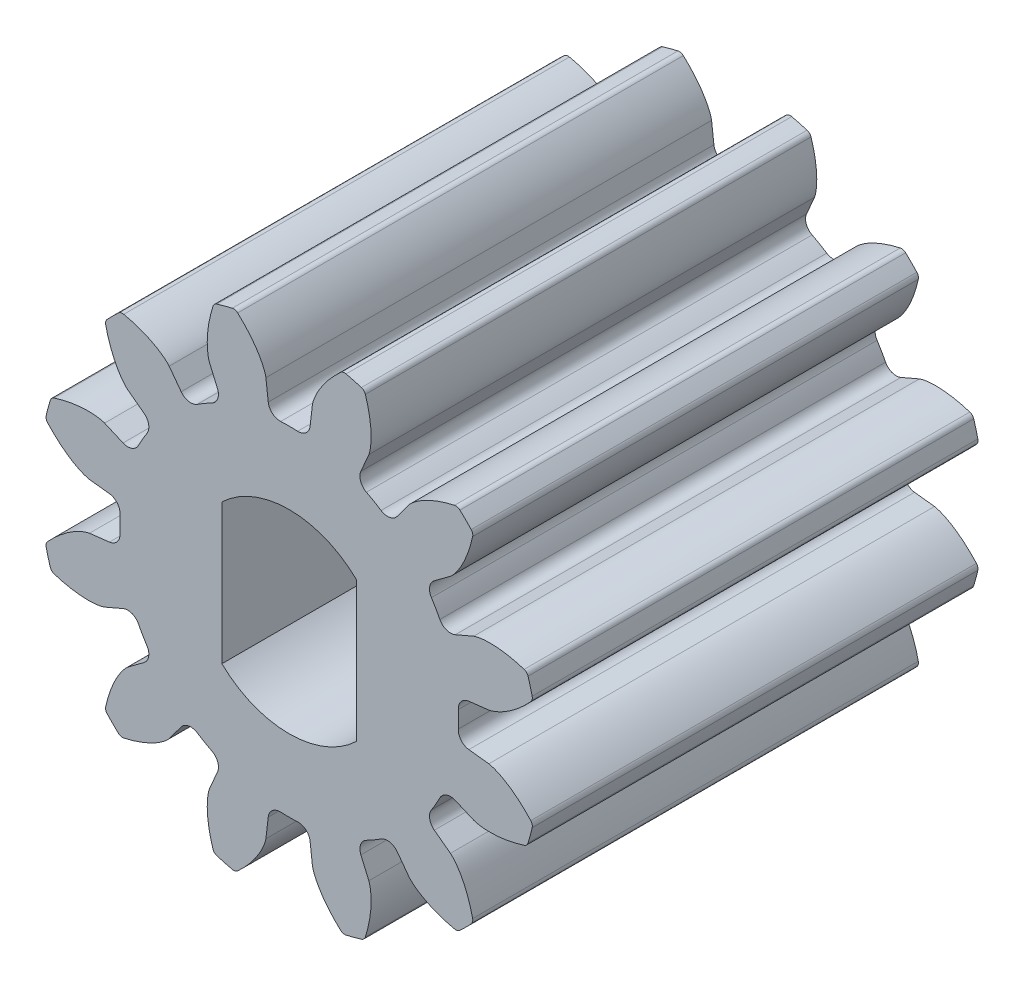
from build123d import *

# Parameters (mm, degrees)
SKETCH1_R                                 = 7.112
BOSS_EXTRUDE1_DEPTH                       = 12.7
CUT_EXTRUDE_DCLTBC_DEPTH                  = 17.200342219
FILLET_TIP_DCLTBC_R                       = 0.170436558
FILLET_ROOT_DCLTBC_R                      = 0.340873116
CIRPATTERN_DCLTBC_COUNT                   = 12
FILLET_TIP_DCLTBC_OF_CIRPATTERN_DCLTBC_R  = 0.170436558
FILLET_ROOT_DCLTBC_OF_CIRPATTERN_DCLTBC_R = 0.340873116
CUT_EXTRUDE1_DEPTH                        = 17.041149826


with BuildPart() as part:
    # Sketch1 → Boss-Extrude1 (new body)
    with BuildSketch(Plane.XY):
        Circle(SKETCH1_R)
    extrude(amount=BOSS_EXTRUDE1_DEPTH)

    # DCLTBC → Cut-Extrude-DCLTBC (cut, through all)
    with BuildSketch(Plane.XY):
        with BuildLine():
            Line((-0.662974567, 5.689872075), (-0.558538882, 4.793569684))
            ThreePointArc((-0.558538882, 4.793569684), (0, 4.826), (0.558538882, 4.793569684))
            Line((0.558538882, 4.793569684), (0.662974567, 5.689872075))
            add(Edge.make_bspline(
                [(0.662974567, 5.689872075), (0.663275397, 5.692145464), (0.664228697, 5.698506862), (0.666463146, 5.710471636), (0.670720167, 5.729889389), (0.677039415, 5.754461613), (0.686229455, 5.786001566), (0.698363916, 5.822849076), (0.713061744, 5.862991037), (0.730512439, 5.906252019), (0.749205224, 5.949022812), (0.769037864, 5.991304795), (0.789858477, 6.033063367), (0.81632592, 6.083195998), (0.849790681, 6.142668259), (0.891392381, 6.211185136), (0.941487387, 6.287669165), (0.995607559, 6.364224937), (1.051365877, 6.438382008), (1.110528205, 6.511878211), (1.169770874, 6.581970613), (1.234132655, 6.653215412), (1.294986248, 6.718191166), (1.366224175, 6.789174393), (1.424614, 6.845936255), (1.48743381, 6.90300279), (1.518375469, 6.930543324), (1.534342146, 6.944518571)],
                knots=[0, 0, 0, 0, 0, 0.005376749, 0.015083688, 0.02853182, 0.046610139, 0.064854849, 0.092110525, 0.119476176, 0.146842496, 0.174208854, 0.201574956, 0.228941013, 0.256307345, 0.307035032, 0.361767352, 0.416499661, 0.471231937, 0.525964282, 0.580696615, 0.635428982, 0.690161387, 0.744893688, 0.799626082, 0.854358408, 0.909090915, 0.909090915, 0.909090915, 0.909090915, 0.909090915], degree=4))
            ThreePointArc((1.534342146, 6.944518571), (0, 7.112), (-1.534342146, 6.944518571))
            add(Edge.make_bspline(
                [(-0.662974567, 5.689872075), (-0.663275397, 5.692145464), (-0.664228697, 5.698506862), (-0.666463146, 5.710471636), (-0.670720167, 5.729889389), (-0.677039415, 5.754461613), (-0.686229455, 5.786001566), (-0.698363916, 5.822849076), (-0.713061744, 5.862991037), (-0.730512439, 5.906252019), (-0.749205224, 5.949022812), (-0.769037864, 5.991304795), (-0.789858477, 6.033063367), (-0.81632592, 6.083195998), (-0.849790681, 6.142668259), (-0.891392381, 6.211185136), (-0.941487387, 6.287669165), (-0.995607559, 6.364224937), (-1.051365877, 6.438382008), (-1.110528205, 6.511878211), (-1.169770874, 6.581970613), (-1.234132655, 6.653215412), (-1.294986248, 6.718191166), (-1.366224175, 6.789174393), (-1.424614, 6.845936255), (-1.48743381, 6.90300279), (-1.518375469, 6.930543324), (-1.534342146, 6.944518571)],
                knots=[0, 0, 0, 0, 0, 0.005376749, 0.015083688, 0.02853182, 0.046610139, 0.064854849, 0.092110525, 0.119476176, 0.146842496, 0.174208854, 0.201574956, 0.228941013, 0.256307345, 0.307035032, 0.361767352, 0.416499661, 0.471231937, 0.525964282, 0.580696615, 0.635428982, 0.690161387, 0.744893688, 0.799626082, 0.854358408, 0.909090915, 0.909090915, 0.909090915, 0.909090915, 0.909090915], degree=4))
        make_face()
    cut_extrude_dcltbc = extrude(amount=CUT_EXTRUDE_DCLTBC_DEPTH, mode=Mode.SUBTRACT)

    # Fillet-Tip-DCLTBC
    fillet_tip_dcltbc_edges = [part.edges().sort_by_distance(p)[0] for p in [
        (1.534342146, 6.944518571, 6.35),
        (-1.534342146, 6.944518571, 6.35),
    ]]
    fillet(fillet_tip_dcltbc_edges, radius=FILLET_TIP_DCLTBC_R)

    # Fillet-Root-DCLTBC
    fillet_root_dcltbc_edges = [part.edges().sort_by_distance(p)[0] for p in [
        (-0.558538882, 4.793569684, 6.35),
        (0.558538882, 4.793569684, 6.35),
    ]]
    fillet(fillet_root_dcltbc_edges, radius=FILLET_ROOT_DCLTBC_R)

    # CirPattern-DCLTBC: Cut-Extrude-DCLTBC ×12 about axis
    cirpattern_dcltbc_axis = Axis((0, 0, 12.7), (0, 0, 1))
    for i in range(1, CIRPATTERN_DCLTBC_COUNT):
        add(cut_extrude_dcltbc.rotate(cirpattern_dcltbc_axis, i * 360 / CIRPATTERN_DCLTBC_COUNT), mode=Mode.SUBTRACT)

    # Fillet-Tip-DCLTBC of CirPattern-DCLTBC
    fillet_tip_dcltbc_of_cirpattern_dcltbc_edges = [part.edges().sort_by_distance(p)[0] for p in [
        (-2.143480009, 6.781300572, 6.35),
        (-4.801038562, 5.246958426, 6.35),
        (-5.246958426, 4.801038562, 6.35),
        (-6.781300572, 2.143480009, 6.35),
        (-6.944518571, 1.534342146, 6.35),
        (-6.944518571, -1.534342146, 6.35),
        (-6.781300572, -2.143480009, 6.35),
        (-5.246958426, -4.801038562, 6.35),
        (-4.801038562, -5.246958426, 6.35),
        (-2.143480009, -6.781300572, 6.35),
        (-1.534342146, -6.944518571, 6.35),
        (1.534342146, -6.944518571, 6.35),
        (2.143480009, -6.781300572, 6.35),
        (4.801038562, -5.246958426, 6.35),
        (5.246958426, -4.801038562, 6.35),
        (6.781300572, -2.143480009, 6.35),
        (6.944518571, -1.534342146, 6.35),
        (6.944518571, 1.534342146, 6.35),
        (6.781300572, 2.143480009, 6.35),
        (5.246958426, 4.801038562, 6.35),
        (4.801038562, 5.246958426, 6.35),
        (2.143480009, 6.781300572, 6.35),
    ]]
    fillet(fillet_tip_dcltbc_of_cirpattern_dcltbc_edges, radius=FILLET_TIP_DCLTBC_OF_CIRPATTERN_DCLTBC_R)

    # Fillet-Root-DCLTBC of CirPattern-DCLTBC
    fillet_root_dcltbc_of_cirpattern_dcltbc_edges = [part.edges().sort_by_distance(p)[0] for p in [
        (-2.880493703, 3.87208368, 6.35),
        (-1.913075981, 4.430622562, 6.35),
        (-4.430622562, 1.913075981, 6.35),
        (-3.87208368, 2.880493703, 6.35),
        (-4.793569684, -0.558538882, 6.35),
        (-4.793569684, 0.558538882, 6.35),
        (-3.87208368, -2.880493703, 6.35),
        (-4.430622562, -1.913075981, 6.35),
        (-1.913075981, -4.430622562, 6.35),
        (-2.880493703, -3.87208368, 6.35),
        (0.558538882, -4.793569684, 6.35),
        (-0.558538882, -4.793569684, 6.35),
        (2.880493703, -3.87208368, 6.35),
        (1.913075981, -4.430622562, 6.35),
        (4.430622562, -1.913075981, 6.35),
        (3.87208368, -2.880493703, 6.35),
        (4.793569684, 0.558538882, 6.35),
        (4.793569684, -0.558538882, 6.35),
        (3.87208368, 2.880493703, 6.35),
        (4.430622562, 1.913075981, 6.35),
        (1.913075981, 4.430622562, 6.35),
        (2.880493703, 3.87208368, 6.35),
    ]]
    fillet(fillet_root_dcltbc_of_cirpattern_dcltbc_edges, radius=FILLET_ROOT_DCLTBC_OF_CIRPATTERN_DCLTBC_R)

    # Sketch4 → Cut-Extrude1 (cut, through all)
    with BuildSketch(Plane.XY.offset(12.7)):
        with BuildLine():
            ThreePointArc((1.9169, 1.996549832), (0, 2.7678), (-1.9169, 1.996549832))
            Line((-1.9169, 1.996549832), (-1.9169, -1.996549832))
            ThreePointArc((-1.9169, -1.996549832), (0, -2.7678), (1.9169, -1.996549832))
            Line((1.9169, -1.996549832), (1.9169, 1.996549832))
        make_face()
    extrude(amount=-CUT_EXTRUDE1_DEPTH, mode=Mode.SUBTRACT)


solid = part.part
